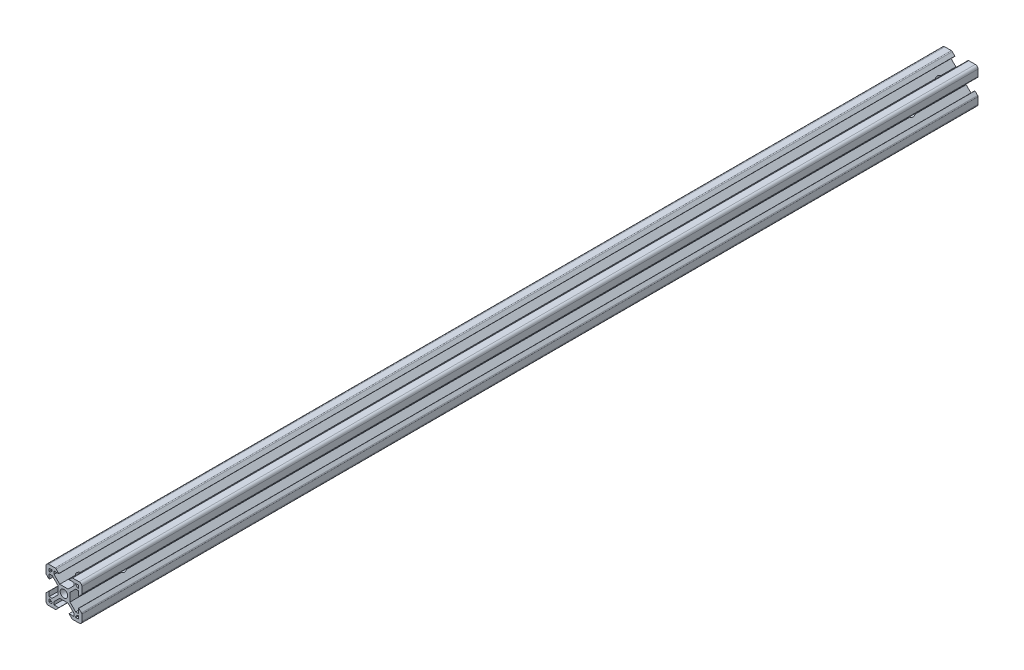
from build123d import *

# Parameters (mm, degrees)
SKETCH6_R           = 2.1
BOSS_EXTRUDE1_DEPTH = 500
SKETCH7_R           = 2.75
CUT_EXTRUDE1_DEPTH  = 501.199960016
SKETCH8_R           = 2.75
CUT_EXTRUDE2_DEPTH  = 501.199960116


with BuildPart() as part:
    # Sketch6 → Boss-Extrude1 (new body)
    with BuildSketch(Plane.XY):
        with BuildLine():
            Line((-3.4, -2.339339828), (-3.4, 2.339339828))
            Line((-3.4, 2.339339828), (-6.560660172, 5.5))
            Line((-6.560660172, 5.5), (-8.2, 5.5))
            Line((-8.2, 5.5), (-8.2, 2.89))
            Line((-8.2, 2.89), (-8.31, 2.89))
            Line((-8.31, 2.89), (-9.768614357, 4.348614357))
            ThreePointArc((-9.768614357, 4.348614357), (-9.939864831, 4.604908803), (-10, 4.907228714))
            Line((-10, 4.907228714), (-10, 8.5))
            ThreePointArc((-10, 8.5), (-9.560660172, 9.560660172), (-8.5, 10))
            Line((-8.5, 10), (-4.907228714, 10))
            ThreePointArc((-4.907228714, 10), (-4.604908803, 9.939864831), (-4.348614357, 9.768614357))
            Line((-4.348614357, 9.768614357), (-2.89, 8.31))
            Line((-2.89, 8.31), (-2.89, 8.2))
            Line((-2.89, 8.2), (-5.5, 8.2))
            Line((-5.5, 8.2), (-5.5, 6.560660172))
            Line((-5.5, 6.560660172), (-2.339339828, 3.4))
            Line((-2.339339828, 3.4), (2.339339828, 3.4))
            Line((2.339339828, 3.4), (5.5, 6.560660172))
            Line((5.5, 6.560660172), (5.5, 8.2))
            Line((5.5, 8.2), (2.89, 8.2))
            Line((2.89, 8.2), (2.89, 8.31))
            Line((2.89, 8.31), (4.348614357, 9.768614357))
            ThreePointArc((4.348614357, 9.768614357), (4.604908803, 9.939864831), (4.907228714, 10))
            Line((4.907228714, 10), (8.5, 10))
            ThreePointArc((8.5, 10), (9.560660172, 9.560660172), (10, 8.5))
            Line((10, 8.5), (10, 4.907228714))
            ThreePointArc((10, 4.907228714), (9.939864831, 4.604908803), (9.768614357, 4.348614357))
            Line((9.768614357, 4.348614357), (8.31, 2.89))
            Line((8.31, 2.89), (8.2, 2.89))
            Line((8.2, 2.89), (8.2, 5.5))
            Line((8.2, 5.5), (6.560660172, 5.5))
            Line((6.560660172, 5.5), (3.4, 2.339339828))
            Line((3.4, 2.339339828), (3.4, -2.339339828))
            Line((3.4, -2.339339828), (6.560660172, -5.5))
            Line((6.560660172, -5.5), (8.2, -5.5))
            Line((8.2, -5.5), (8.2, -2.89))
            Line((8.2, -2.89), (8.31, -2.89))
            Line((8.31, -2.89), (9.768614357, -4.348614357))
            ThreePointArc((9.768614357, -4.348614357), (9.939864831, -4.604908803), (10, -4.907228714))
            Line((10, -4.907228714), (10, -8.5))
            ThreePointArc((10, -8.5), (9.560660172, -9.560660172), (8.5, -10))
            Line((8.5, -10), (4.907228714, -10))
            ThreePointArc((4.907228714, -10), (4.604908803, -9.939864831), (4.348614357, -9.768614357))
            Line((4.348614357, -9.768614357), (2.89, -8.31))
            Line((2.89, -8.31), (2.89, -8.2))
            Line((2.89, -8.2), (5.5, -8.2))
            Line((5.5, -8.2), (5.5, -6.560660172))
            Line((5.5, -6.560660172), (2.339339828, -3.4))
            Line((2.339339828, -3.4), (-2.339339828, -3.4))
            Line((-2.339339828, -3.4), (-5.5, -6.560660172))
            Line((-5.5, -6.560660172), (-5.5, -8.2))
            Line((-5.5, -8.2), (-2.89, -8.2))
            Line((-2.89, -8.2), (-2.89, -8.31))
            Line((-2.89, -8.31), (-4.348614357, -9.768614357))
            ThreePointArc((-4.348614357, -9.768614357), (-4.604908803, -9.939864831), (-4.907228714, -10))
            Line((-4.907228714, -10), (-8.5, -10))
            ThreePointArc((-8.5, -10), (-9.560660172, -9.560660172), (-10, -8.5))
            Line((-10, -8.5), (-10, -4.907228714))
            ThreePointArc((-10, -4.907228714), (-9.939864831, -4.604908803), (-9.768614357, -4.348614357))
            Line((-9.768614357, -4.348614357), (-8.31, -2.89))
            Line((-8.31, -2.89), (-8.2, -2.89))
            Line((-8.2, -2.89), (-8.2, -5.5))
            Line((-8.2, -5.5), (-6.560660172, -5.5))
            Line((-6.560660172, -5.5), (-3.4, -2.339339828))
        make_face()
        Circle(SKETCH6_R, mode=Mode.SUBTRACT)
        Polygon((-7.66, 6.57), (-6.57, 7.66), (-6.57, 8.2), (-8.2, 8.2), (-8.2, 6.57), align=None, mode=Mode.SUBTRACT)
        Polygon((8.2, 6.57), (7.66, 6.57), (6.57, 7.66), (6.57, 8.2), (8.2, 8.2), align=None, mode=Mode.SUBTRACT)
        Polygon((7.66, -6.57), (6.57, -7.66), (6.57, -8.2), (8.2, -8.2), (8.2, -6.57), align=None, mode=Mode.SUBTRACT)
        Polygon((-8.2, -6.57), (-7.66, -6.57), (-6.57, -7.66), (-6.57, -8.2), (-8.2, -8.2), align=None, mode=Mode.SUBTRACT)
    extrude(amount=-BOSS_EXTRUDE1_DEPTH)

    # Sketch7 → Cut-Extrude1 (cut, symmetric)
    with BuildSketch(Plane(origin=(0, 0, 0), x_dir=(1, 0, 0), z_dir=(0, 1, 0))):
        with Locations((0, 490)):
            Circle(SKETCH7_R)
    cut_extrude1 = extrude(amount=CUT_EXTRUDE1_DEPTH, both=True, mode=Mode.SUBTRACT)

    # Sketch8 → Cut-Extrude2 (cut, symmetric)
    with BuildSketch(Plane(origin=(0, 0, 0), x_dir=(0, 0, -1), z_dir=(1, 0, 0))):
        with Locations((470, 0)):
            Circle(SKETCH8_R)
    cut_extrude2 = extrude(amount=CUT_EXTRUDE2_DEPTH, both=True, mode=Mode.SUBTRACT)

    # Mirror1: Cut-Extrude1, Cut-Extrude2 across plane
    add(cut_extrude1.mirror(Plane.XY.offset(-250)), mode=Mode.SUBTRACT)
    add(cut_extrude2.mirror(Plane.XY.offset(-250)), mode=Mode.SUBTRACT)


solid = part.part
